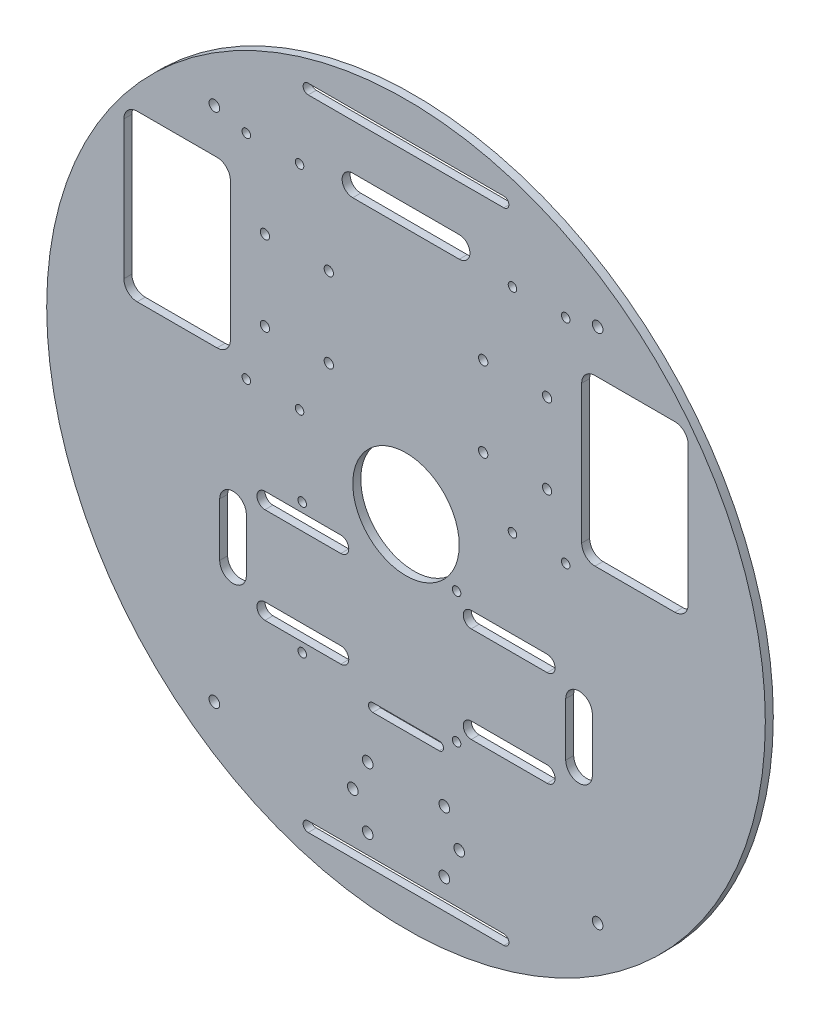
from build123d import *

# Parameters (mm, degrees)
SKETCH_1_R          = 135
SKETCH_1_R_2        = 2
SKETCH_1_W          = 40
SKETCH_1_H          = 62
SKETCH_1_R_3        = 1.75
EXTRUDE_1_DEPTH     = 3
FILLET_1_R          = 5
SKETCH_2_R          = 20
SKETCH_2_R_2        = 2
SKETCH_2_R_3        = 1.6
CUT_EXTRUDE_1_DEPTH = 10


with BuildPart() as part:
    # 草图1 → 凸台-拉伸1 (new body)
    with BuildSketch(Plane.XY):
        Circle(SKETCH_1_R)
        with Locations((-14.4, -110.804246301)):
            Circle(SKETCH_1_R_2, mode=Mode.SUBTRACT)
        with Locations((-20, -99.304246301)):
            Circle(SKETCH_1_R_2, mode=Mode.SUBTRACT)
        with Locations((-14.4, -87.804246301)):
            Circle(SKETCH_1_R_2, mode=Mode.SUBTRACT)
        with Locations((14.4, -110.804246301)):
            Circle(SKETCH_1_R_2, mode=Mode.SUBTRACT)
        with Locations((14.4, -87.804246301)):
            Circle(SKETCH_1_R_2, mode=Mode.SUBTRACT)
        with Locations((20, -99.304246301)):
            Circle(SKETCH_1_R_2, mode=Mode.SUBTRACT)
        with Locations((-86, 49.65212315)):
            Rectangle(SKETCH_1_W, SKETCH_1_H, mode=Mode.SUBTRACT)
        with Locations((-53, 34.65212315)):
            Circle(SKETCH_1_R_3, mode=Mode.SUBTRACT)
        with Locations((-53, 64.65212315)):
            Circle(SKETCH_1_R_3, mode=Mode.SUBTRACT)
        with Locations((-29, 34.65212315)):
            Circle(SKETCH_1_R_3, mode=Mode.SUBTRACT)
        with Locations((-29, 64.65212315)):
            Circle(SKETCH_1_R_3, mode=Mode.SUBTRACT)
        with Locations((29, 34.65212315)):
            Circle(SKETCH_1_R_3, mode=Mode.SUBTRACT)
        with Locations((29, 64.65212315)):
            Circle(SKETCH_1_R_3, mode=Mode.SUBTRACT)
        with Locations((53, 34.65212315)):
            Circle(SKETCH_1_R_3, mode=Mode.SUBTRACT)
        with Locations((53, 64.65212315)):
            Circle(SKETCH_1_R_3, mode=Mode.SUBTRACT)
        with Locations((86, 49.65212315)):
            Rectangle(SKETCH_1_W, SKETCH_1_H, mode=Mode.SUBTRACT)
    extrude(amount=EXTRUDE_1_DEPTH)

    # 圆角1
    fillet_1_edges = [part.edges().sort_by_distance(p)[0] for p in [
        (106, 80.65212315, 1.5),
        (66, 80.65212315, 1.5),
        (66, 18.65212315, 1.5),
        (106, 18.65212315, 1.5),
        (-66, 18.65212315, 1.5),
        (-106, 18.65212315, 1.5),
        (-106, 80.65212315, 1.5),
        (-66, 80.65212315, 1.5),
    ]]
    fillet(fillet_1_edges, radius=FILLET_1_R)

    # 草图2 → 切除-拉伸1 (cut)
    with BuildSketch(Plane.XY.offset(3)):
        Circle(SKETCH_2_R)
        with Locations((-72, 97)):
            Circle(SKETCH_2_R_2)
        with Locations((72, 97)):
            Circle(SKETCH_2_R_2)
        with Locations((72, -97)):
            Circle(SKETCH_2_R_2)
        with Locations((-72, -97)):
            Circle(SKETCH_2_R_2)
        with Locations((-60, 94)):
            Circle(SKETCH_2_R_3)
        with Locations((-60, 14)):
            Circle(SKETCH_2_R_3)
        with Locations((-40, 94)):
            Circle(SKETCH_2_R_3)
        with Locations((-40, 14)):
            Circle(SKETCH_2_R_3)
        with Locations((60, 14)):
            Circle(SKETCH_2_R_3)
        with Locations((60, 94)):
            Circle(SKETCH_2_R_3)
        with Locations((40, 94)):
            Circle(SKETCH_2_R_3)
        with Locations((40, 14)):
            Circle(SKETCH_2_R_3)
        with Locations((-39, -15.5)):
            Circle(SKETCH_2_R_3)
        with Locations((19, -15.5)):
            Circle(SKETCH_2_R_3)
        with Locations((-39, -64.5)):
            Circle(SKETCH_2_R_3)
        with Locations((19, -64.5)):
            Circle(SKETCH_2_R_3)
        with BuildLine():
            Line((24.505636669, -55), (53, -55))
            ThreePointArc((53, -55), (56, -58), (53, -61))
            Line((53, -61), (24.505636669, -61))
            ThreePointArc((24.505636669, -61), (21.505636669, -58), (24.505636669, -55))
        make_face()
        with BuildLine():
            Line((-53, -19), (-24.505636669, -19))
            ThreePointArc((-24.505636669, -19), (-21.505636669, -22), (-24.505636669, -25))
            Line((-24.505636669, -25), (-53, -25))
            ThreePointArc((-53, -25), (-56, -22), (-53, -19))
        make_face()
        with BuildLine():
            Line((-53, -61), (-24.505636669, -61))
            ThreePointArc((-24.505636669, -61), (-21.505636669, -58), (-24.505636669, -55))
            Line((-24.505636669, -55), (-53, -55))
            ThreePointArc((-53, -55), (-56, -58), (-53, -61))
        make_face()
        with BuildLine():
            Line((24.505636669, -25), (53, -25))
            ThreePointArc((53, -25), (56, -22), (53, -19))
            Line((53, -19), (24.505636669, -19))
            ThreePointArc((24.505636669, -19), (21.505636669, -22), (24.505636669, -25))
        make_face()
        with BuildLine():
            Line((-70, -30), (-70, -50))
            ThreePointArc((-70, -50), (-65, -55), (-60, -50))
            Line((-60, -50), (-60, -30))
            ThreePointArc((-60, -30), (-65, -25), (-70, -30))
        make_face()
        with BuildLine():
            Line((60, -30), (60, -50))
            ThreePointArc((60, -50), (65, -55), (70, -50))
            Line((70, -50), (70, -30))
            ThreePointArc((70, -30), (65, -25), (60, -30))
        make_face()
        with BuildLine():
            Line((-36.755588957, 121.9), (36.755588957, 121.9))
            ThreePointArc((36.755588957, 121.9), (38.655588957, 120), (36.755588957, 118.1))
            Line((36.755588957, 118.1), (-36.755588957, 118.1))
            ThreePointArc((-36.755588957, 118.1), (-38.655588957, 120), (-36.755588957, 121.9))
        make_face()
        with BuildLine():
            Line((-36.755588957, -118.1), (36.755588957, -118.1))
            ThreePointArc((36.755588957, -118.1), (38.655588957, -120), (36.755588957, -121.9))
            Line((36.755588957, -121.9), (-36.755588957, -121.9))
            ThreePointArc((-36.755588957, -121.9), (-38.655588957, -120), (-36.755588957, -118.1))
        make_face()
        with BuildLine():
            Line((12.5, -70.7), (-12.5, -70.7))
            ThreePointArc((-12.5, -70.7), (-14.1, -69.1), (-12.5, -67.5))
            Line((-12.5, -67.5), (12.5, -67.5))
            ThreePointArc((12.5, -67.5), (14.1, -69.1), (12.5, -70.7))
        make_face()
        with BuildLine():
            Line((20, 101), (-20, 101))
            ThreePointArc((-20, 101), (-24, 97), (-20, 93))
            Line((-20, 93), (20, 93))
            ThreePointArc((20, 93), (24, 97), (20, 101))
        make_face()
    extrude(amount=-CUT_EXTRUDE_1_DEPTH, mode=Mode.SUBTRACT)


solid = part.part
